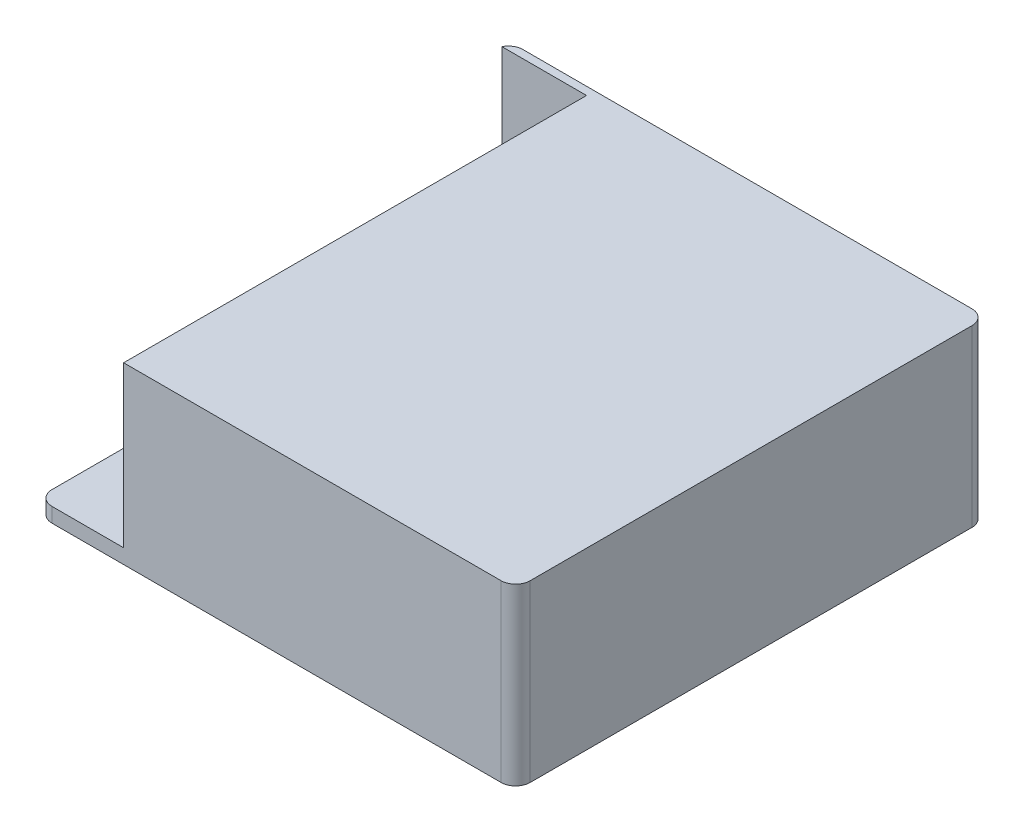
from build123d import *

# Parameters (mm, degrees)
BOSS_EXTRUDE1_DEPTH = 36
SKETCH2_W           = 25.092767626
SKETCH2_H           = 98.018623538
CUT_EXTRUDE1_DEPTH  = 33
SKETCH3_W           = 17.75334897
SKETCH3_H           = 58.288408131
BOSS_EXTRUDE2_DEPTH = 12
SKETCH4_R           = 1.5
CUT_EXTRUDE2_DEPTH  = 5


with BuildPart() as part:
    # Sketch1 → Boss-Extrude1 (new body)
    with BuildSketch(Plane(origin=(0, 0, 0), x_dir=(1, 0, 0), z_dir=(0, 1, 0))):
        with BuildLine():
            Line((-46.25, 48.5), (46.25, 48.5))
            ThreePointArc((46.25, 48.5), (48.371320344, 47.621320344), (49.25, 45.5))
            Line((49.25, 45.5), (49.25, -45.5))
            ThreePointArc((49.25, -45.5), (48.371320344, -47.621320344), (46.25, -48.5))
            Line((46.25, -48.5), (-46.25, -48.5))
            ThreePointArc((-46.25, -48.5), (-48.371320344, -47.621320344), (-49.25, -45.5))
            Line((-49.25, -45.5), (-49.25, 45.5))
            ThreePointArc((-49.25, 45.5), (-48.371320344, 47.621320344), (-46.25, 48.5))
        make_face()
    extrude(amount=BOSS_EXTRUDE1_DEPTH)

    # Sketch2 → Cut-Extrude1 (cut)
    with BuildSketch(Plane(origin=(0, 36, 0), x_dir=(1, 0, 0), z_dir=(0, 1, 0))):
        with Locations((-44.043034843, -2.156409718)):
            Rectangle(SKETCH2_W, SKETCH2_H)
    extrude(amount=-CUT_EXTRUDE1_DEPTH, mode=Mode.SUBTRACT)

    # Sketch4 → Cut-Extrude2 (cut)
    with BuildSketch(Plane.XZ):
        with Locations((-28.75, -3)):
            Circle(SKETCH4_R)
        with Locations((26.25, -3)):
            Circle(SKETCH4_R)
    extrude(amount=-CUT_EXTRUDE2_DEPTH, mode=Mode.SUBTRACT)


with BuildPart() as body_2:
    # Sketch3 → Boss-Extrude2 (new body)
    with BuildSketch(Plane(origin=(0, 3, 0), x_dir=(1, 0, 0), z_dir=(0, 1, 0))):
        with Locations((-40.373325515, 8.560293123)):
            Rectangle(SKETCH3_W, SKETCH3_H)
    extrude(amount=BOSS_EXTRUDE2_DEPTH)


solid = Compound([part.part, body_2.part])
